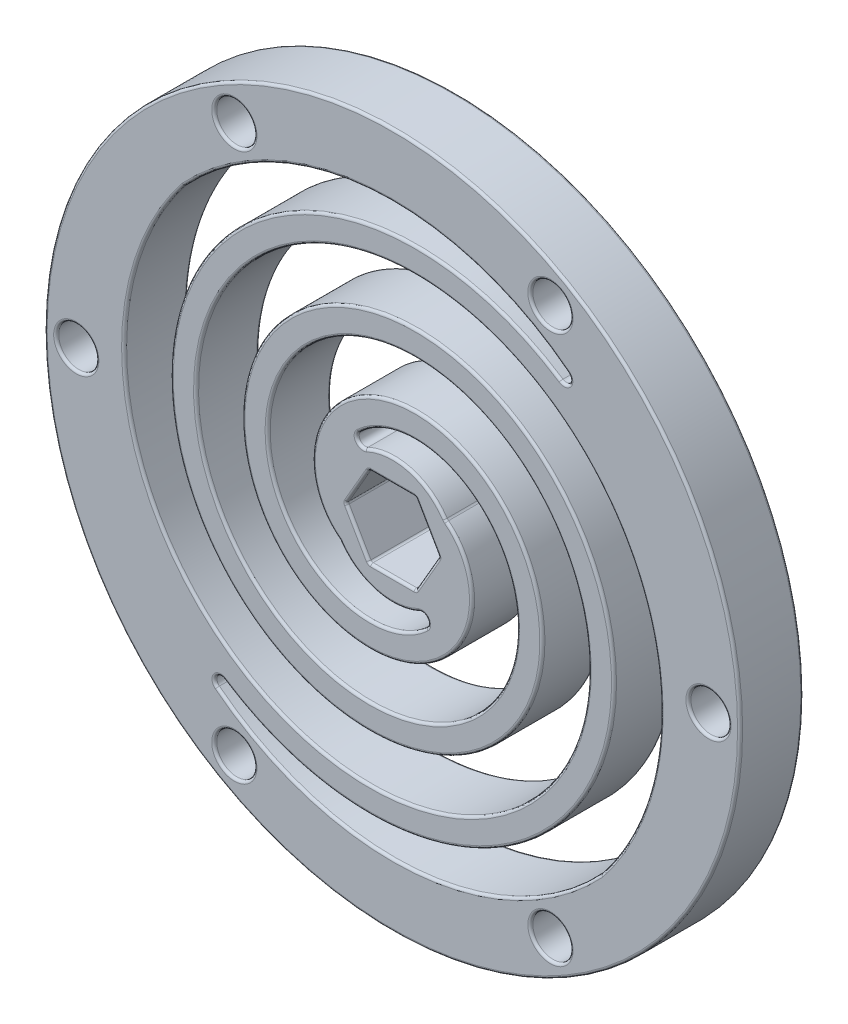
from build123d import *

# Parameters (mm, degrees)
SKETCH4_R           = 27.5
SKETCH4_R_2         = 1.5875
BOSS_EXTRUDE1_DEPTH = 5
CIRPATTERN1_COUNT   = 2
FILLET1_R           = 0.5
FILLET2_R           = 0.2


with BuildPart() as part:
    # Sketch4 → Boss-Extrude1 (new body)
    with BuildSketch(Plane.XY):
        Circle(SKETCH4_R)
        with Locations((-25, 0)):
            Circle(SKETCH4_R_2, mode=Mode.SUBTRACT)
        with Locations((-12.5, 21.650635095)):
            Circle(SKETCH4_R_2, mode=Mode.SUBTRACT)
        with Locations((12.5, 21.650635095)):
            Circle(SKETCH4_R_2, mode=Mode.SUBTRACT)
        with Locations((25, 0)):
            Circle(SKETCH4_R_2, mode=Mode.SUBTRACT)
        with Locations((12.5, -21.650635095)):
            Circle(SKETCH4_R_2, mode=Mode.SUBTRACT)
        with Locations((-12.5, -21.650635095)):
            Circle(SKETCH4_R_2, mode=Mode.SUBTRACT)
        Polygon((3.666174209, 0), (1.833087105, 3.175), (-1.833087105, 3.175), (-3.666174209, 0), (-1.833087105, -3.175), (1.833087105, -3.175), align=None, mode=Mode.SUBTRACT)
        with BuildLine():
            ThreePointArc((21.097422754, 7.819766822), (-22.066143486, 4.397193612), (16.488355211, -15.30960948))
            add(Edge.make_bspline(
                [(-4.182800832, 2.739375331), (-4.119502419, 3.016691571), (-4.029669753, 3.296210638), (-3.667882385, 4.142418698), (-3.300205813, 4.704138966), (-2.33594072, 5.694215141), (-1.73331953, 6.128271279), (-0.351524916, 6.769159483), (0.435065133, 6.979043144), (2.095121477, 7.100397831), (2.97637117, 7.012078983), (4.708997112, 6.502736266), (5.567542669, 6.07922731), (7.126334563, 4.911720901), (7.832290789, 4.162990185), (8.964335066, 2.407000763), (9.39404618, 1.393442677), (9.877968724, -0.78455062), (9.933364092, -1.956021319), (9.615784181, -4.307728903), (9.241502736, -5.494858812), (8.066395605, -7.718556542), (7.262016853, -8.76104887), (5.288221045, -10.540083485), (4.113502279, -11.280900133), (1.517051263, -12.327432304), (0.088955766, -12.635307735), (-2.851107233, -12.733384117), (-4.369708946, -12.523429799), (-7.30111362, -11.565241868), (-8.720022324, -10.814615745), (-11.259493471, -8.824416542), (-12.384917883, -7.580553212), (-14.167772223, -4.722113101), (-14.828270058, -3.101902801), (-15.559023401, 0.332569016), (-15.630227353, 2.153108014), (-15.12735885, 5.772221474), (-14.552047334, 7.576958385), (-12.780489366, 10.934729314), (-11.581007606, 12.49308213), (-8.667243601, 15.143768162), (-6.948152193, 16.239962807), (-3.174870862, 17.79641866), (-1.11489704, 18.258654465), (3.105275375, 18.44665096), (5.27153057, 18.172300659), (9.440940606, 16.873395292), (11.44970411, 15.846694248), (15.044360929, 13.123375432), (16.634760529, 11.422865858), (19.169882203, 7.521709194), (20.117495391, 5.315913789), (21.21174524, 0.647157804), (21.359344194, -1.821579221), (20.789361375, -6.726632286), (20.070731727, -9.168661634), (18.264936665, -12.800025603), (17.442527519, -14.098938552), (16.488355211, -15.30960948)],
                knots=[0.047404028, 0.047404028, 0.047404028, 0.047404028, 0.0625, 0.0625, 0.09375, 0.09375, 0.125, 0.125, 0.15625, 0.15625, 0.1875, 0.1875, 0.21875, 0.21875, 0.25, 0.25, 0.28125, 0.28125, 0.3125, 0.3125, 0.34375, 0.34375, 0.375, 0.375, 0.40625, 0.40625, 0.4375, 0.4375, 0.46875, 0.46875, 0.5, 0.5, 0.53125, 0.53125, 0.5625, 0.5625, 0.59375, 0.59375, 0.625, 0.625, 0.65625, 0.65625, 0.6875, 0.6875, 0.71875, 0.71875, 0.75, 0.75, 0.78125, 0.78125, 0.8125, 0.8125, 0.84375, 0.84375, 0.875, 0.875, 0.90625, 0.90625, 0.924887906, 0.924887906, 0.924887906, 0.924887906], degree=3))
            ThreePointArc((-4.182800832, 2.739375331), (4.999998755, -0.003528919), (-4.186663477, -2.733468296))
            add(Edge.make_bspline(
                [(-4.186663477, -2.733468296), (-5.518069509, -1.768079709), (-6.355828582, -0.021549167), (-6.27089711, 2.729584689), (-6.09304179, 3.557592261), (-5.408565335, 5.158558861), (-4.905323031, 5.922588802), (-3.596355902, 7.266593866), (-2.796794136, 7.839670811), (-0.971071078, 8.686456839), (0.047082362, 8.956017428), (2.191471448, 9.112778171), (3.308932057, 8.998944306), (5.50458545, 8.353484697), (6.574339347, 7.82393357), (8.517450622, 6.368579026), (9.383720033, 5.447599122), (10.774835413, 3.289747224), (11.294765884, 2.059784963), (11.8820261, -0.583300861), (11.9471574, -1.988312779), (11.566009435, -4.810747475), (11.120462884, -6.219858898), (9.723996521, -8.862442711), (8.776607076, -10.088408847), (6.451666677, -12.183939413), (5.079983941, -13.047695796), (2.045921961, -14.270612559), (0.391020212, -14.626343775), (-3.019811464, -14.74012434), (-4.767564628, -14.497515761), (-8.146030678, -13.393196926), (-9.768851679, -12.533661472), (-12.678039397, -10.253713112), (-13.95774229, -8.838033987), (-15.988898424, -5.581493039), (-16.735708368, -3.747349168), (-17.564005408, 0.14556883), (-17.643419612, 2.196447865), (-17.076103776, 6.27938479), (-16.430115111, 8.303314193), (-14.440221049, 12.07491442), (-13.099781461, 13.815192661), (-9.840166908, 16.78050308), (-7.926769908, 17.999759513), (-3.721557831, 19.7343842), (-1.437147042, 20.246282619), (3.249513467, 20.455059812), (5.643611114, 20.151190882), (10.258592299, 18.713475768), (12.47154379, 17.581698324), (16.438004946, 14.576699838), (18.184745719, 12.708125025), (20.146122049, 9.689872915), (20.653950922, 8.772942236), (21.097422754, 7.819766822)],
                knots=[-0.044468426, -0.044468426, -0.044468426, -0.044468426, 0.03125, 0.03125, 0.0625, 0.0625, 0.09375, 0.09375, 0.125, 0.125, 0.15625, 0.15625, 0.1875, 0.1875, 0.21875, 0.21875, 0.25, 0.25, 0.28125, 0.28125, 0.3125, 0.3125, 0.34375, 0.34375, 0.375, 0.375, 0.40625, 0.40625, 0.4375, 0.4375, 0.46875, 0.46875, 0.5, 0.5, 0.53125, 0.53125, 0.5625, 0.5625, 0.59375, 0.59375, 0.625, 0.625, 0.65625, 0.65625, 0.6875, 0.6875, 0.71875, 0.71875, 0.75, 0.75, 0.78125, 0.78125, 0.8125, 0.8125, 0.825200665, 0.825200665, 0.825200665, 0.825200665], degree=3))
        make_face(mode=Mode.SUBTRACT)
    boss_extrude1 = extrude(amount=BOSS_EXTRUDE1_DEPTH)

    # CirPattern1: Boss-Extrude1 ×2 about axis
    cirpattern1_axis = Axis((0, 0, 5), (0, 0, -1))
    for i in range(1, CIRPATTERN1_COUNT):
        add(boss_extrude1.rotate(cirpattern1_axis, i * 360 / CIRPATTERN1_COUNT))

    # Fillet1
    fillet1_edges = [part.edges().sort_by_distance(p)[0] for p in [
        (4.186663477, 2.733468296, 2.5),
        (-4.186663477, -2.733468296, 2.5),
        (4.182800832, -2.739375331, 2.5),
        (-4.182800832, 2.739375331, 2.5),
        (-21.097422754, -7.819766822, 2.5),
        (21.097422754, 7.819766822, 2.5),
    ]]
    fillet(fillet1_edges, radius=FILLET1_R)

    # Fillet2
    fillet2_edges = [part.edges().sort_by_distance(p)[0] for p in [
        (1.833087105, 3.175, 2.5),
        (3.666174209, 0, 2.5),
        (-3.666174209, 0, 2.5),
        (-1.833087105, 3.175, 2.5),
        (1.833087105, -3.175, 2.5),
        (-1.833087105, -3.175, 2.5),
        (-14.0875, -21.650635095, 0),
        (10.9125, -21.650635095, 0),
        (23.4125, 0, 0),
        (10.9125, 21.650635095, 0),
        (-14.0875, 21.650635095, 0),
        (-26.5875, 0, 0),
        (-27.5, 0, 0),
        (0, -3.175, 0),
        (-2.749630657, -1.5875, 0),
        (-2.749630657, 1.5875, 0),
        (0, 3.175, 0),
        (2.749630657, 1.5875, 0),
        (2.749630657, -1.5875, 0),
        (2.736692343, -4.703255015, 0),
        (-13.955860529, 8.679491122, 0),
        (13.976083927, 17.02435119, 0),
        (-13.955860529, 8.679491122, 0),
        (-4.192010208, -2.73889278, 0),
        (0, -3.175, 0),
        (4.192010208, 2.73889278, 0),
        (0, 3.175, 0),
        (-2.736692343, 4.703255015, 0),
        (8.008563264, 13.342697019, 0),
        (13.955860529, -8.679491122, 0),
        (-13.976083926, -17.02435119, 0),
        (-14.0875, -21.650635095, 5),
        (23.4125, 0, 5),
        (-14.0875, 21.650635095, 5),
        (-27.5, 0, 5),
        (-26.5875, 0, 5),
        (10.9125, 21.650635095, 5),
        (10.9125, -21.650635095, 5),
        (0, 3.175, 5),
        (-2.749630657, 1.5875, 5),
        (-2.749630657, -1.5875, 5),
        (0, -3.175, 5),
        (2.749630657, -1.5875, 5),
        (2.749630657, 1.5875, 5),
        (2.736692343, -4.703255015, 5),
        (0, -3.175, 5),
        (-4.192010208, -2.73889278, 5),
        (-13.955860529, 8.679491122, 5),
        (13.976083926, 17.02435119, 5),
        (-13.955860529, 8.679491122, 5),
        (-2.736692343, 4.703255015, 5),
        (0, 3.175, 5),
        (4.192010208, 2.73889278, 5),
        (-13.976083926, -17.02435119, 5),
        (13.955860529, -8.679491122, 5),
        (8.008563264, 13.342697019, 5),
    ]]
    fillet(fillet2_edges, radius=FILLET2_R)


solid = part.part
